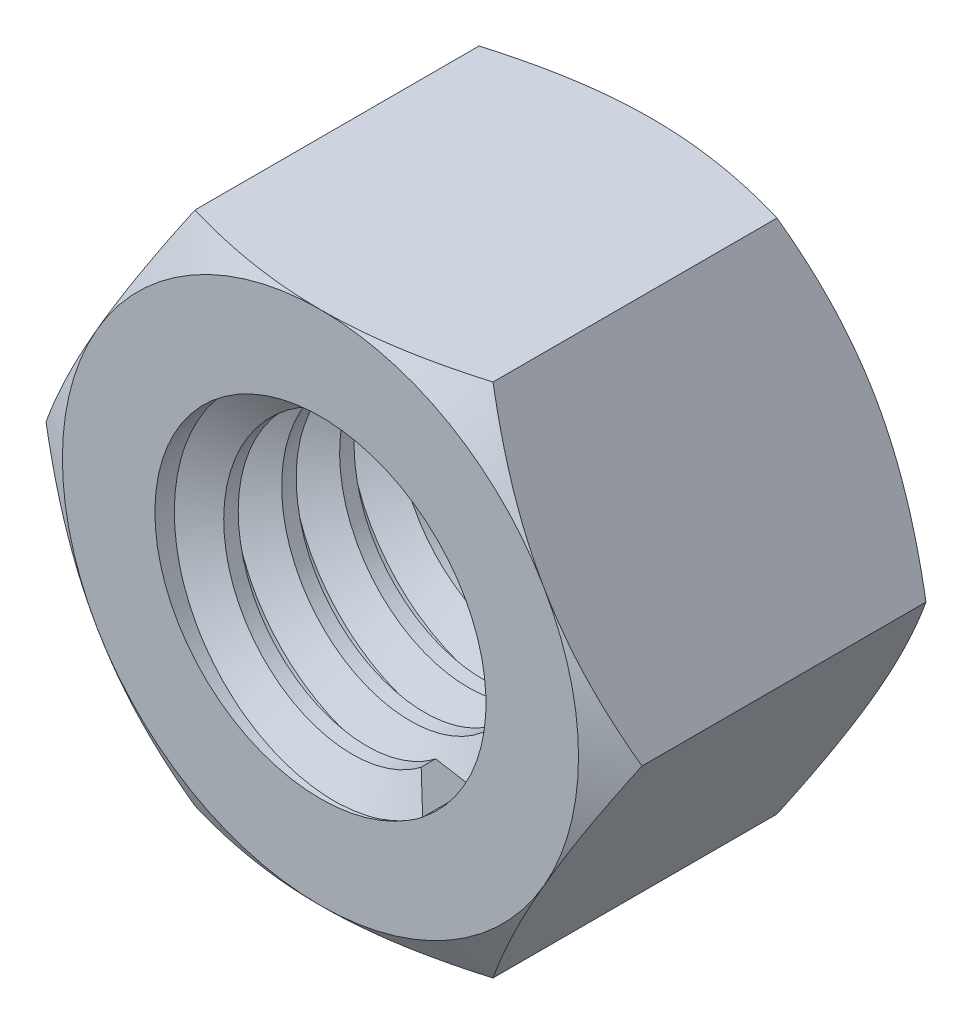
from build123d import *

# Parameters (mm, degrees)
SKETCH1_R           = 5
BOSS_EXTRUDE1_DEPTH = 5
THREAD1_PITCH       = 1.75


with BuildPart() as part:
    # Sketch1 → Boss-Extrude1 (new, symmetric)
    with BuildSketch(Plane.XY):
        Polygon((9, 0), (4.5, 7.794228634), (-4.5, 7.794228634), (-9, 0), (-4.5, -7.794228634), (4.5, -7.794228634), align=None)
        Circle(SKETCH1_R, mode=Mode.SUBTRACT)
    extrude(amount=BOSS_EXTRUDE1_DEPTH, both=True)

    # Sketch2 → Cut-Revolve1 (revolve, cut)
    with BuildSketch(Plane(origin=(0, 0, 0), x_dir=(0, 0, -1), z_dir=(1, 0, 0))):
        Polygon((-5, 7.794228634), (-5, 12.459120921), (-2.248276299, 12.459120921), align=None)
        Polygon((2.248276299, 12.459120921), (5, 7.794228634), (5, 12.459120921), align=None)
    revolve(axis=Axis((0, 0, 0), (0, 0, -1)), mode=Mode.SUBTRACT)

    # Thread1: the profile of Thread Profile1 profile screwed along a right-hand helix of 4.857143 turns, 10 arcs to a turn; built about Z, then put on its axis
    thread1_z = Axis((0, 0, 0), (0, 0, 1))
    thread1_corners = [(5.0003, 0, -0.000173205), (5.0003, 0, 1.5314232), (4.052784719, 0, 0.984374998), (4.052784719, 0, 0.546874998)]
    with BuildLine(mode=Mode.PRIVATE) as thread1_profile:
        Line(thread1_corners[0], thread1_corners[1])
        Line(thread1_corners[1], thread1_corners[2])
        Line(thread1_corners[2], thread1_corners[3])
        Line(thread1_corners[3], thread1_corners[0])
    thread1_cap = Face(thread1_profile.wire())
    thread1_turn_angles = [0, 18, 36, 54, 72, 90, 108, 126, 144, 162, 180, 198, 216, 234, 252, 270, 288, 306, 324, 342, 360]
    thread1_turn_weights = [1, 0.9510565162951535, 1, 0.9510565162951535, 1, 0.9510565162951535, 1, 0.9510565162951535, 1, 0.9510565162951535, 1, 0.9510565162951535, 1, 0.9510565162951535, 1, 0.9510565162951535, 1, 0.9510565162951535, 1, 0.9510565162951535, 1]
    thread1_turn_rails = [Edge.make_bspline([Vector(p[0], p[1], 0).rotate(thread1_z, thread1_turn_angles[k]) / thread1_turn_weights[k] + Vector(0, 0, p[2] + THREAD1_PITCH * thread1_turn_angles[k] / 360) for k in range(21)], [0, 0, 0, 1, 1, 2, 2, 3, 3, 4, 4, 5, 5, 6, 6, 7, 7, 8, 8, 9, 9, 10, 10, 10], 2, thread1_turn_weights) for p in thread1_corners]
    thread1_turn_sides = [Face.make_surface_from_curves(thread1_turn_rails[p[0]], thread1_turn_rails[p[1]]) for p in [(0, 1), (1, 2), (2, 3), (3, 0)]]
    thread1_last_angles = [1440, 1458, 1476, 1494, 1512, 1530, 1548, 1566, 1584, 1602, 1620, 1638, 1656, 1674, 1692, 1710, 1728, 1738.285714286, 1748.571428571]
    thread1_last_weights = [1, 0.9510565162951535, 1, 0.9510565162951535, 1, 0.9510565162951535, 1, 0.9510565162951535, 1, 0.9510565162951535, 1, 0.9510565162951535, 1, 0.9510565162951535, 1, 0.9510565162951535, 1, 0.9839295885986296, 1]
    thread1_last_rails = [Edge.make_bspline([Vector(p[0], p[1], 0).rotate(thread1_z, thread1_last_angles[k]) / thread1_last_weights[k] + Vector(0, 0, p[2] + THREAD1_PITCH * thread1_last_angles[k] / 360) for k in range(19)], [0, 0, 0, 1, 1, 2, 2, 3, 3, 4, 4, 5, 5, 6, 6, 7, 7, 8, 8, 9, 9, 9], 2, thread1_last_weights) for p in thread1_corners]
    thread1_last_sides = [Face.make_surface_from_curves(thread1_last_rails[p[0]], thread1_last_rails[p[1]]) for p in [(0, 1), (1, 2), (2, 3), (3, 0)]]
    thread1 = Plane(origin=(0, 0, -5), x_dir=(1, 0, 0), z_dir=(0, 0, 1)) * Solid(Shell([*[p.moved(Location((0, 0, THREAD1_PITCH * i))) for i in range(4) for p in thread1_turn_sides], *thread1_last_sides, thread1_cap, thread1_cap.rotate(thread1_z, 1748.571428571).moved(Location((0, 0, THREAD1_PITCH * 1748.571428571 / 360)))]))
    add(thread1)


solid = part.part
